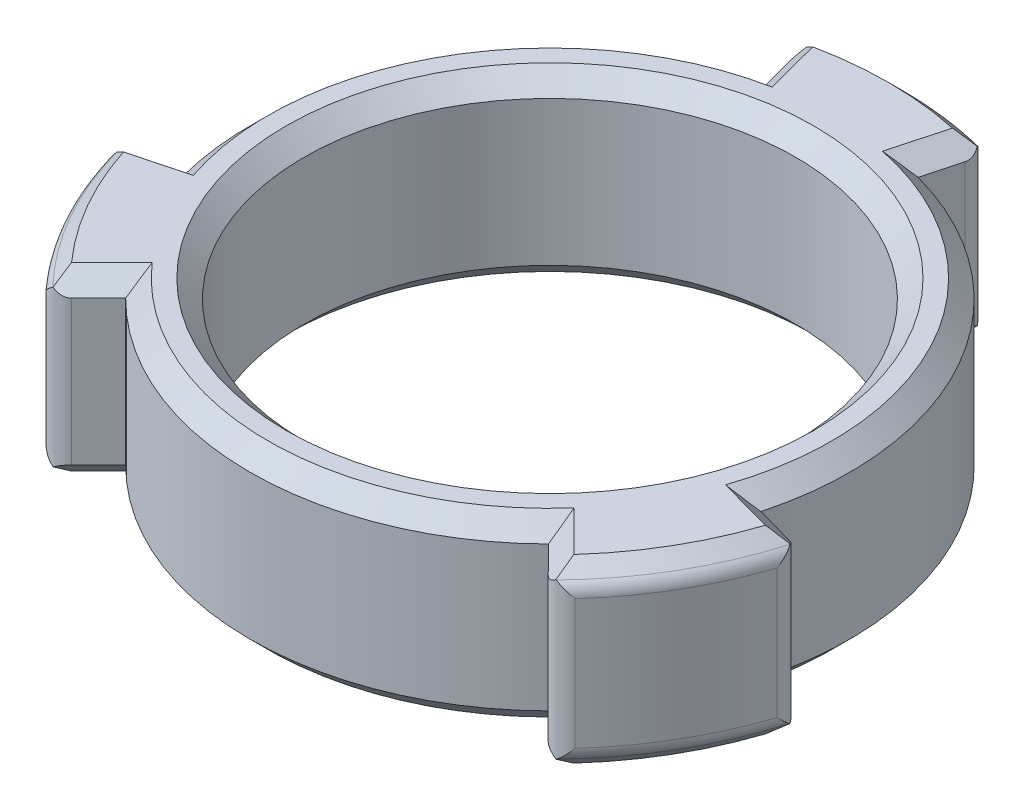
from build123d import *

# Parameters (mm, degrees)
IZIM1_R                     = 19.75
IZIM1_R_2                   = 13.6
Y_KSEKLIK_EKSTR_ZYON1_DEPTH = 10
KES_EKSTR_ZYON1_DEPTH       = 30.666900748
DAIRESEL_KAPLAMA1_COUNT     = 3
PAH1_SIZE                   = 1
RADYUS1_START               = 0.694856743
RADYUS1_DEPTH               = 8.610286514


with BuildPart() as part:
    # Çizim1 → Yükseklik-Ekstrüzyon1 (new body)
    with BuildSketch(Plane(origin=(0, 0, 0), x_dir=(1, 0, 0), z_dir=(0, 1, 0))):
        with Locations(Location((0, 0, 0), (0, 0, 270))):
            Circle(IZIM1_R)
        with Locations(Location((0, 0, 0), (0, 0, 270))):
            Circle(IZIM1_R_2, mode=Mode.SUBTRACT)
    extrude(amount=Y_KSEKLIK_EKSTR_ZYON1_DEPTH)

    # Çizim7 → Kes-Ekstrüzyon1 (cut, through all)
    with BuildSketch(Plane(origin=(0, 10, 0), x_dir=(1, 0, 0), z_dir=(0, 1, 0))):
        with BuildLine():
            Line((-11.779473554, -11.696324329), (-26.852626673, -26.66307872))
            Line((-26.852626673, -26.66307872), (23.589745071, -23.75744468))
            Line((23.589745071, -23.75744468), (11.696324329, -11.779473554))
            ThreePointArc((11.696324329, -11.779473554), (-0.058795381, -16.599895876), (-11.779473554, -11.696324329))
        make_face()
    kes_ekstr_zyon1 = extrude(amount=-KES_EKSTR_ZYON1_DEPTH, mode=Mode.SUBTRACT)

    # Dairesel Kaplama1: Kes-Ekstrüzyon1 ×3 about axis
    dairesel_kaplama1_axis = Axis((0, 0, 0), (0, 1, 0))
    for i in range(1, DAIRESEL_KAPLAMA1_COUNT):
        add(kes_ekstr_zyon1.rotate(dairesel_kaplama1_axis, i * 360 / DAIRESEL_KAPLAMA1_COUNT), mode=Mode.SUBTRACT)

    # Pah1
    pah1_edges = [part.edges().sort_by_distance(p)[0] for p in [
        (12.806065944, 0, 12.897104328),
        (-12.897104328, 0, 12.806065944),
        (12.806065944, 10, 12.897104328),
        (-0.058795381, 10, 16.599895876),
        (-12.897104328, 10, 12.806065944),
        (-0.058795381, 0, 16.599895876),
        (17.068918272, 0, 9.935518559),
        (0.069952336, 10, -19.749876118),
        (-17.138870608, 10, 9.814357559),
        (0.069952336, 0, -19.749876118),
        (-17.138870608, 0, 9.814357559),
        (4.766187011, 0, -17.538930594),
        (17.538930594, 0, 4.766187011),
        (4.766187011, 10, -17.538930594),
        (14.405329219, 10, -8.249029645),
        (17.538930594, 10, 4.766187011),
        (14.405329219, 0, -8.249029645),
        (-17.572252955, 0, 4.641826266),
        (-4.641826266, 0, -17.572252955),
        (17.068918272, 10, 9.935518559),
        (-17.572252955, 10, 4.641826266),
        (-14.346533839, 10, -8.350866232),
        (-4.641826266, 10, -17.572252955),
        (0, 0, -13.6),
        (-14.346533839, 0, -8.350866232),
        (0, 10, -13.6),
    ]]
    chamfer(pah1_edges, length=PAH1_SIZE)

    # Radyus1: read off the stored shape, not the designer's step
    # Radyus1 outline → Radyus1 (cut)
    with BuildSketch(Plane(origin=(0, 0, 0), x_dir=(1, 0, 0), z_dir=(0, 1, 0)).offset(RADYUS1_START)):
        with BuildLine():
            ThreePointArc((5.179212845, 19.058810412), (4.668953833, 19.190189424), (4.15537172, 19.30790993))
            ThreePointArc((4.15537172, 19.30790993), (4.799199075, 18.85019622), (4.90997621, 18.068055612))
            Line((4.90997621, 18.068055612), (5.179212845, 19.058810412))
        make_face()
        with BuildLine():
            ThreePointArc((-4.781863676, 18.102383263), (-4.665548842, 18.88371953), (-4.018495317, 19.336861053))
            ThreePointArc((-4.018495317, 19.336861053), (-4.532898446, 19.22278158), (-5.04407531, 19.095020405))
            Line((-5.04407531, 19.095020405), (-4.781863676, 18.102383263))
        make_face()
        with BuildLine():
            ThreePointArc((13.91580756, -14.014735101), (14.284714628, -13.63852734), (14.643454634, -13.252612436))
            ThreePointArc((14.643454634, -13.252612436), (13.925149256, -13.581326427), (13.192407052, -13.286191936))
            Line((13.192407052, -13.286191936), (13.91580756, -14.014735101))
        make_face()
        with BuildLine():
            ThreePointArc((18.068055612, -4.90997621), (18.686555252, -5.401375945), (18.75546056, -6.188311497))
            ThreePointArc((18.75546056, -6.188311497), (18.913866403, -5.685785583), (19.058810412, -5.179212845))
            Line((19.058810412, -5.179212845), (18.068055612, -4.90997621))
        make_face()
        with BuildLine():
            ThreePointArc((-19.095020405, -5.04407531), (-18.953668461, -5.551662084), (-18.798826353, -6.055297494))
            ThreePointArc((-18.798826353, -6.055297494), (-18.724348331, -5.268869793), (-18.102383263, -4.781863676))
            Line((-18.102383263, -4.781863676), (-19.095020405, -5.04407531))
        make_face()
        with BuildLine():
            ThreePointArc((-13.286191936, -13.192407052), (-14.02100641, -13.482343585), (-14.736965243, -13.148549556))
            ThreePointArc((-14.736965243, -13.148549556), (-14.380967957, -13.536995997), (-14.014735101, -13.91580756))
            Line((-14.014735101, -13.91580756), (-13.286191936, -13.192407052))
        make_face()
    extrude(amount=RADYUS1_DEPTH, mode=Mode.SUBTRACT)

    # Radyus1 2 outline → Radyus1 2 (revolve, cut)
    with BuildSketch(Plane.XY):
        with BuildLine():
            ThreePointArc((19.457106781, 9.292893219), (19.673879533, 8.96846987), (19.75, 8.585786438))
            Line((19.75, 8.585786438), (19.75, 9.292893219))
            Line((19.75, 9.292893219), (19.457106781, 9.292893219))
        make_face()
        with BuildLine():
            Line((19.75, 0.707106781), (19.75, 1.414213562))
            ThreePointArc((19.75, 1.414213562), (19.673879533, 1.03153013), (19.457106781, 0.707106781))
            Line((19.457106781, 0.707106781), (19.75, 0.707106781))
        make_face()
    revolve(axis=Axis((0, 0, 0), (0, 1, 0)), mode=Mode.SUBTRACT)


solid = part.part
